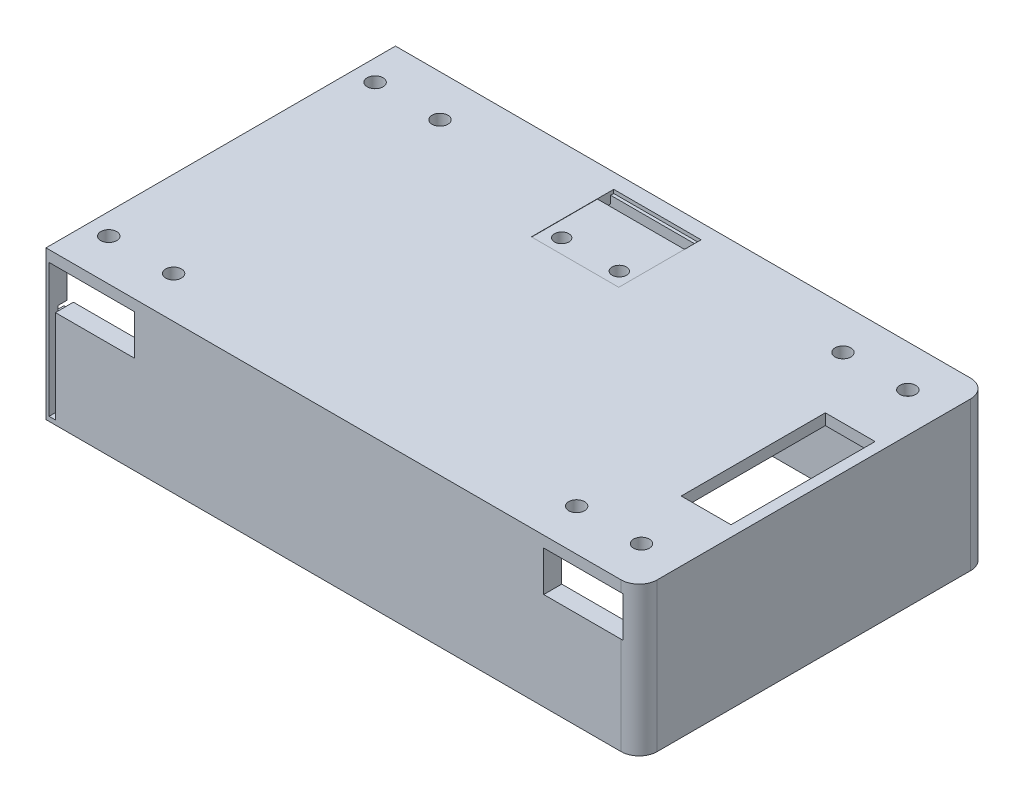
from build123d import *
from build123d.topology import SkipClean

# Parameters (mm, degrees)
CROQUIS1_W                  = 114
CROQUIS1_H                  = 34.2
SALIENTE_EXTRUIR1_DEPTH     = 97
VACIADO1_T                  = -5
SALIENTE_EXTRUIR2_DEPTH     = 97
CORTAR_EXTRUIR1_REACH       = 128.031
CROQUIS3_W                  = 13.814275766
CROQUIS3_H                  = 40
REDONDEO2_R                 = 5
CROQUIS6_W                  = 12.3
CROQUIS6_H                  = 10.4
CORTAR_EXTRUIR3_DEPTH       = 124.459670354
SALIENTE_EXTRUIR3_DEPTH     = 97
CROQUIS8_W                  = 13.814275766
CROQUIS8_H                  = 40
CORTAR_EXTRUIR4_DEPTH       = 127.030661617
CROQUIS9_W                  = 104
CROQUIS9_H                  = 87
CORTAR_EXTRUIR5_DEPTH       = 10
CORTAR_EXTRUIR6_START       = -33.316303
CROQUIS11_W                 = 1.5
CROQUIS11_H                 = 39.999512223
CROQUIS11_H_2               = 40
CORTAR_EXTRUIR6_DEPTH       = 33.316303
CORTAR_EXTRUIR7_START       = -33.316303
CROQUIS13_W                 = 15.314275766
CROQUIS13_H                 = 4.5
CORTAR_EXTRUIR7_DEPTH       = 33.316303
CROQUIS14_W                 = 40
CROQUIS14_H                 = 2.980218128
SALIENTE_EXTRUIR4_DEPTH     = 15.498885391
CORTAR_EXTRUIR8_DEPTH       = 20.498885391
CROQUIS19_W                 = 5
CROQUIS19_H                 = 21.536410229
CROQUIS19_H_2               = 2.349460024
SALIENTE_EXTRUIR5_DEPTH     = 22
CROQUIS20_W                 = 5
CROQUIS20_H                 = 36.296521374
SALIENTE_EXTRUIR6_DEPTH     = 19.5
CROQUIS21_W                 = 87
CROQUIS21_H                 = 2.349460024
SALIENTE_EXTRUIR7_DEPTH     = 144.815390375
CROQUIS23_W                 = 1.39816901
CROQUIS23_H                 = 33.700902132
CORTAR_EXTRUIR9_DEPTH       = 95.5
CROQUIS24_W                 = 22.493754325
CROQUIS24_H                 = 22.211308676
CORTAR_EXTRUIR10_DEPTH      = 1.5
CROQUIS25_W                 = 5.544572311
CROQUIS25_H                 = 16.748281631
CORTAR_EXTRUIR11_DEPTH      = 1.5
SALIENTE_EXTRUIR8_DEPTH     = 46
CROQUIS27_W                 = 22
CROQUIS27_H                 = 22
CORTAR_EXTRUIR12_DEPTH      = 1
CROQUIS28_W                 = 21.106040847
CROQUIS28_H                 = 4.330702007
CORTAR_EXTRUIR14_DEPTH      = 1.5
SALIENTE_EXTRUIR9_DEPTH     = 1.832280796
CROQUIS30_W                 = 21.106040847
CROQUIS30_H                 = 4.330702007
CORTAR_EXTRUIR15_DEPTH      = 10
CROQUIS31_W                 = 22
CROQUIS31_H                 = 22
CROQUIS31_W_2               = 24.249006592
CROQUIS31_H_2               = 22.850930842
CORTAR_EXTRUIR16_DEPTH      = 1
CROQUIS32_W                 = 27.93304274
CROQUIS32_H                 = 36.647527424
SALIENTE_EXTRUIR10_DEPTH    = 2.349460023
CROQUIS36_W                 = 87
CROQUIS36_H                 = 1.737561639
CROQUIS36_W_2               = 2.5
CORTAR_EXTRUIR17_DEPTH      = 147
SALIENTE_EXTRUIR11_START    = 5
CROQUIS37_W                 = 15.314275766
CROQUIS37_H                 = 48.999512223
SALIENTE_EXTRUIR11_DEPTH    = 5
CROQUIS38_W                 = 6
CROQUIS38_H                 = 6
CROQUIS38_R                 = 1.5
SALIENTE_EXTRUIR12_DEPTH    = 1.5
CROQUIS39_R                 = 1.5
CORTAR_EXTRUIR18_DEPTH      = 1.5
CROQUIS40_W                 = 1.75
CROQUIS40_H                 = 39
CORTAR_EXTRUIR19_DEPTH      = 95.5
CROQUIS41_W                 = 87
CROQUIS41_H                 = 12.325399335
CORTAR_EXTRUIR20_DEPTH      = 10
CROQUIS42_W                 = 22
CROQUIS42_H                 = 12.410651121
CROQUIS42_W_2               = 12.2
CROQUIS42_H_2               = 10.4
SALIENTE_EXTRUIR13_DEPTH    = 5
CORTAR_EXTRUIR21_REACH      = 139.785
CROQUIS43_W                 = 22
CROQUIS43_H                 = 9.218142551
SALIENTE_EXTRUIR14_REACH    = 139.785
CROQUIS46_R                 = 2.2
CORTAR_EXTRUIR22_DEPTH      = 1.078378822
CORTAR_EXTRUIR23_DEPTH      = 1.271081201
CROQUIS48_R                 = 2.2
CORTAR_EXTRUIR24_DEPTH      = 1.078378822
CORTAR_EXTRUIR25_DEPTH      = 1.018142551
CROQUIS50_W                 = 22
CROQUIS50_H                 = 13.185536059
CORTAR_EXTRUIR26_DEPTH      = 97
SALIENTE_EXTRUIR15_START    = 2
SALIENTE_EXTRUIR15_DEPTH    = 2
CROQUIS52_W                 = 48.73866477
CROQUIS52_H                 = 24.884100376
CORTAR_EXTRUIR27_DEPTH      = 10
CORTAR_EXTRUIR28_DEPTH      = 3
SALIENTE_EXTRUIR16_START    = 3
CROQUIS56_R                 = 2
SALIENTE_EXTRUIR16_DEPTH    = 3
CORTAR_EXTRUIR30_START      = -3
CROQUIS57_R                 = 2.2
CORTAR_EXTRUIR30_DEPTH      = 3
CORTAR_EXTRUIR31_DEPTH      = 10
CORTAR_EXTRUIR31_DEPTH_BACK = 14.629666
CROQUIS59_W                 = 16.895766511
CROQUIS59_H                 = 87.983147409
CORTAR_EXTRUIR32_DEPTH      = 3
SALIENTE_EXTRUIR17_DEPTH    = 3


with BuildPart() as part:
    # Croquis1 → Saliente-Extruir1 (new body)
    with BuildSketch(Plane.XY):
        with Locations((0, -8.9)):
            Rectangle(CROQUIS1_W, CROQUIS1_H)
    extrude(amount=-SALIENTE_EXTRUIR1_DEPTH)

    # Vaciado1
    vaciado1_openings = [part.faces().sort_by_distance(p)[0] for p in [
        (0, -26, -48.5),
    ]]
    offset(amount=VACIADO1_T, openings=vaciado1_openings, kind=Kind.INTERSECTION)

    # Croquis2 → Saliente-Extruir2 (add, through all)
    with BuildSketch(Plane(origin=(0, 0, -97), x_dir=(-1, 0, 0), z_dir=(0, 0, -1))):
        Polygon((71.814275766, 8.2), (67.33466189, 8.2), (67.33466189, -3.967393508), (57, -3.967393508), (57, -26), (67.33466189, -26), (71.814275766, -26), align=None)
        Polygon((-57, 8.2), (57, 8.2), (67.33466189, 8.2), (71.814275766, 8.2), (71.814275766, 10.296521374), (-71.814275766, 10.296521374), (-71.814275766, 8.2), (-67.33466189, 8.2), align=None)
        Polygon((-67.33466189, -3.967393508), (-67.33466189, 8.2), (-71.814275766, 8.2), (-71.814275766, -26), (-67.33466189, -26), (-57, -26), (-57, -3.967393508), align=None)
    extrude(amount=-SALIENTE_EXTRUIR2_DEPTH)

    # Croquis3 → Cortar-Extruir1 (cut, up to next)
    with BuildSketch(Plane.XZ.offset(26), mode=Mode.PRIVATE) as cortar_extruir1_sk1:
        with Locations((-61.907137883, -48.5)):
            Rectangle(CROQUIS3_W, CROQUIS3_H)
    cortar_extruir1_tool1 = extrude(cortar_extruir1_sk1.sketch, amount=-CORTAR_EXTRUIR1_REACH, mode=Mode.PRIVATE) & part.part
    # Croquis3 → Cortar-Extruir1 (cut, up to next)
    with BuildSketch(Plane.XZ.offset(26), mode=Mode.PRIVATE) as cortar_extruir1_sk2:
        with Locations((61.907137883, -48.5)):
            Rectangle(CROQUIS3_W, CROQUIS3_H)
    cortar_extruir1_tool2 = extrude(cortar_extruir1_sk2.sketch, amount=-CORTAR_EXTRUIR1_REACH, mode=Mode.PRIVATE) & part.part
    add(cortar_extruir1_tool1.solids().sort_by_distance((-61.907138, -26, -48.5))[0], mode=Mode.SUBTRACT)
    add(cortar_extruir1_tool2.solids().sort_by_distance((61.907138, -26, -48.5))[0], mode=Mode.SUBTRACT)

    # Redondeo2
    # the kernel refuses this fillet: 5 mm, written as the material it takes off along each edge
    with BuildSketch(Plane(origin=(71.814275766, -38.5, -97), x_dir=(0, 0, 1), z_dir=(0, 1, 0)), Plane(origin=(71.814275766, -38.5, 0), x_dir=(-1, 0, 0), z_dir=(0, 1, 0)), Plane(origin=(-71.814275766, 22.796521374, -97), x_dir=(0, 0, 1), z_dir=(0, -1, 0)), Plane(origin=(-71.814275766, 22.796521374, 0), x_dir=(1, 0, 0), z_dir=(0, -1, 0))) as redondeo2_piece_1:
        with BuildLine():
            CenterArc((REDONDEO2_R, -REDONDEO2_R), REDONDEO2_R, 90, 90)
            Line((0, -REDONDEO2_R), (0, 0))
            Line((0, 0), (REDONDEO2_R, 0))
        make_face()
    extrude(amount=61.296521374, mode=Mode.SUBTRACT)

    # Croquis6 → Cortar-Extruir3 (cut, through all)
    with BuildSketch(Plane(origin=(0, 0, -97), x_dir=(-1, 0, 0), z_dir=(0, 0, -1))):
        with Locations((-60.617330945, 2.116303246)):
            Rectangle(CROQUIS6_W, CROQUIS6_H)
        with Locations((60.617330945, 2.116303246)):
            Rectangle(CROQUIS6_W, CROQUIS6_H)
    extrude(amount=-CORTAR_EXTRUIR3_DEPTH, mode=Mode.SUBTRACT)

    # Croquis7 → Saliente-Extruir3 (add, through all)
    with BuildSketch(Plane(origin=(0, 0, -97), x_dir=(-1, 0, 0), z_dir=(0, 0, -1))):
        Polygon((57, 8.2), (57, 7.316303246), (66.667330945, 7.316303246), (66.667330945, -3.083696754), (57, -3.083696754), (57, -3.967393508), (66.814275766, -3.967393508), (67.33466189, -3.967393508), (67.33466189, 8.2), (66.814275766, 8.2), align=None)
        Polygon((-66.667330945, 7.32503221), (-57, 7.32503221), (-57, 8.2), (-66.814275766, 8.2), (-67.33466189, 8.2), (-67.33466189, -3.967393508), (-66.814275766, -3.967393508), (-57, -3.967393508), (-57, -3.083696754), (-66.667330945, -3.083696754), align=None)
    extrude(amount=-SALIENTE_EXTRUIR3_DEPTH)

    # Croquis8 → Cortar-Extruir4 (cut, through all)
    with BuildSketch(Plane(origin=(0, 10.296521374, 0), x_dir=(1, 0, 0), z_dir=(0, 1, 0))):
        with Locations((-61.907137883, 48.5)):
            Rectangle(CROQUIS8_W, CROQUIS8_H)
        with Locations((61.907137883, 48.5)):
            Rectangle(CROQUIS8_W, CROQUIS8_H)
    extrude(amount=-CORTAR_EXTRUIR4_DEPTH, mode=Mode.SUBTRACT)

    # Croquis9 → Cortar-Extruir5 (cut)
    with BuildSketch(Plane.XZ.offset(-3.2)):
        with Locations((0, -48.5)):
            Rectangle(CROQUIS9_W, CROQUIS9_H)
    extrude(amount=-CORTAR_EXTRUIR5_DEPTH, mode=Mode.SUBTRACT)

    # Croquis11 → Cortar-Extruir6 (cut)
    with SkipClean():  # the faces are left unmerged after this step: merging them gives an invalid solid
        with BuildSketch(Plane.XZ.offset(26).offset(CORTAR_EXTRUIR6_START)):
            with Locations((54.25, -48.499756112)):
                Rectangle(CROQUIS11_W, CROQUIS11_H)
            with Locations((-54.25, -48.5)):
                Rectangle(CROQUIS11_W, CROQUIS11_H_2)
        extrude(amount=CORTAR_EXTRUIR6_DEPTH, mode=Mode.SUBTRACT)

    # Croquis13 → Cortar-Extruir7 (cut)
    with BuildSketch(Plane.XZ.offset(26).offset(CORTAR_EXTRUIR7_START)):
        with Locations((-61.157137883, -26.25)):
            Rectangle(CROQUIS13_W, CROQUIS13_H)
        with Locations((-61.157137883, -70.75)):
            Rectangle(CROQUIS13_W, CROQUIS13_H)
        with Locations((61.157137883, -26.25)):
            Rectangle(CROQUIS13_W, CROQUIS13_H)
        with Locations((61.157137883, -70.749512223)):
            Rectangle(CROQUIS13_W, CROQUIS13_H)
    extrude(amount=CORTAR_EXTRUIR7_DEPTH, mode=Mode.SUBTRACT)

    # Croquis14 → Saliente-Extruir4 (add)
    with BuildSketch(Plane.ZY.offset(55)):
        with Locations((-48.5, 8.80641231)):
            Rectangle(CROQUIS14_W, CROQUIS14_H)
    extrude(amount=SALIENTE_EXTRUIR4_DEPTH)

    # Croquis16 → Cortar-Extruir8 (cut)
    with BuildSketch(Plane.ZY.offset(71.814275766)):
        Polygon((-5, 10.296521374), (-98.41592061, 10.296521374), (-98.41592061, -27.13789471), (0, -27.13789471), (0, 10.296521374), align=None)
    extrude(amount=-CORTAR_EXTRUIR8_DEPTH, mode=Mode.SUBTRACT)

    # Croquis19 → Saliente-Extruir5 (add)
    with BuildSketch(Plane.ZY.offset(51.315390375)):
        with Locations((-2.5, -15.231794886)):
            Rectangle(CROQUIS19_W, CROQUIS19_H)
        with Locations((-94.5, -15.231794886)):
            Rectangle(CROQUIS19_W, CROQUIS19_H)
        with Locations((-2.5, 9.121791362)):
            Rectangle(CROQUIS19_W, CROQUIS19_H_2)
        with Locations((-94.5, 9.121791362)):
            Rectangle(CROQUIS19_W, CROQUIS19_H_2)
    extrude(amount=SALIENTE_EXTRUIR5_DEPTH)

    # Croquis20 → Saliente-Extruir6 (add)
    with BuildSketch(Plane.ZY.offset(73.315390375)):
        with Locations((-2.5, -7.851739313)):
            Rectangle(CROQUIS20_W, CROQUIS20_H)
        with Locations((-94.5, -7.851739313)):
            Rectangle(CROQUIS20_W, CROQUIS20_H)
    extrude(amount=SALIENTE_EXTRUIR6_DEPTH)

    # Croquis21 → Saliente-Extruir7 (add)
    with BuildSketch(Plane.ZY.offset(-52)):
        with Locations((-48.5, 9.121791362)):
            Rectangle(CROQUIS21_W, CROQUIS21_H)
    extrude(amount=SALIENTE_EXTRUIR7_DEPTH)

    # Croquis23 → Cortar-Extruir9 (cut)
    with BuildSketch(Plane.XY):
        with Locations((-91.682194084, -7.778032427)):
            Rectangle(CROQUIS23_W, CROQUIS23_H)
    extrude(amount=-CORTAR_EXTRUIR9_DEPTH, mode=Mode.SUBTRACT)

    # Croquis24 → Cortar-Extruir10 (cut)
    with BuildSketch(Plane(origin=(0, 10.296521374, 0), x_dir=(1, 0, 0), z_dir=(0, 1, 0))):
        with Locations((-78.515448222, 48.5)):
            Rectangle(CROQUIS24_W, CROQUIS24_H)
    extrude(amount=-CORTAR_EXTRUIR10_DEPTH, mode=Mode.SUBTRACT)

    # Croquis25 → Cortar-Extruir11 (cut)
    with BuildSketch(Plane(origin=(0, 8.796521374, 0), x_dir=(1, 0, 0), z_dir=(0, 1, 0))):
        with Locations((-86.990039229, 48.639589487)):
            Rectangle(CROQUIS25_W, CROQUIS25_H)
    extrude(amount=-CORTAR_EXTRUIR11_DEPTH, mode=Mode.SUBTRACT)

    # Croquis26 → Saliente-Extruir8 (add)
    with BuildSketch(Plane(origin=(-89.762325384, 0, 0), x_dir=(0, 0, -1), z_dir=(1, 0, 0))):
        Polygon((59.605654338, 10.296521374), (37.394345662, 10.296521374), (37.394345662, 8.796521374), (40.265448671, 8.796521374), (40.265448671, 7.94706135), (57.013730302, 7.94706135), (57.013730302, 8.796521374), (59.605654338, 8.796521374), align=None)
    extrude(amount=SALIENTE_EXTRUIR8_DEPTH)

    # Croquis27 → Cortar-Extruir12 (cut)
    with BuildSketch(Plane(origin=(0, 10.296521374, 0), x_dir=(1, 0, 0), z_dir=(0, 1, 0))):
        with Locations((-71.548762692, 81)):
            Rectangle(CROQUIS27_W, CROQUIS27_H)
    extrude(amount=-CORTAR_EXTRUIR12_DEPTH, mode=Mode.SUBTRACT)

    # Croquis28 → Cortar-Extruir14 (cut)
    with BuildSketch(Plane(origin=(0, 9.296521374, 0), x_dir=(1, 0, 0), z_dir=(0, 1, 0))):
        with Locations((-71.487233446, 89.534648997)):
            Rectangle(CROQUIS28_W, CROQUIS28_H)
    extrude(amount=-CORTAR_EXTRUIR14_DEPTH, mode=Mode.SUBTRACT)

    # Croquis29 → Saliente-Extruir9 (add)
    with BuildSketch(Plane.ZY.offset(90.983109579)):
        Polygon((-92, 7.94706135), (-5, 7.94706135), (-5, -24.628483493), (0, -24.628483493), (0, 9.072418639), (-95.5, 9.072418639), (-95.5, -24.628483493), (-92, -24.628483493), align=None)
    extrude(amount=SALIENTE_EXTRUIR9_DEPTH)

    # Croquis30 → Cortar-Extruir15 (cut)
    with BuildSketch(Plane.XZ.offset(-7.94706135)):
        with Locations((-16.385259295, -89.834648996)):
            Rectangle(CROQUIS30_W, CROQUIS30_H)
        with Locations((-71.487233446, -89.534648997)):
            Rectangle(CROQUIS30_W, CROQUIS30_H)
    extrude(amount=-CORTAR_EXTRUIR15_DEPTH, mode=Mode.SUBTRACT)

    # Croquis31 → Cortar-Extruir16 (cut)
    with BuildSketch(Plane(origin=(0, 10.296521374, 0), x_dir=(1, 0, 0), z_dir=(0, 1, 0))):
        with Locations((-71.548762692, 81)):
            Rectangle(CROQUIS31_W, CROQUIS31_H)
        with Locations((-15.962454673, 81.425465421)):
            Rectangle(CROQUIS31_W_2, CROQUIS31_H_2)
    extrude(amount=-CORTAR_EXTRUIR16_DEPTH, mode=Mode.SUBTRACT)

    # Croquis32 → Saliente-Extruir10 (add)
    with BuildSketch(Plane.XZ.offset(-7.94706135)):
        with Locations((-69.098869005, -73.676236288)):
            Rectangle(CROQUIS32_W, CROQUIS32_H)
    extrude(amount=-SALIENTE_EXTRUIR10_DEPTH)

    # Croquis36 → Cortar-Extruir17 (cut)
    with BuildSketch(Plane.ZY.offset(92.815390375)):
        with Locations((-48.5, -5.247118805)):
            Rectangle(CROQUIS36_W, CROQUIS36_H)
        with Locations((-3.75, -5.247118805)):
            Rectangle(CROQUIS36_W_2, CROQUIS36_H)
        with Locations((-93.25, -5.247118805)):
            Rectangle(CROQUIS36_W_2, CROQUIS36_H)
    extrude(amount=-CORTAR_EXTRUIR17_DEPTH, mode=Mode.SUBTRACT)

    # Croquis37 → Saliente-Extruir11 (add)
    with BuildSketch(Plane.XZ.offset(26).offset(SALIENTE_EXTRUIR11_START)):
        with BuildLine():
            Line((66.814275766, 0), (-92.815390375, 0))
            Line((-92.815390375, 0), (-92.815390375, -5))
            Line((-92.815390375, -5), (52, -5))
            Line((52, -5), (52, -92))
            Line((52, -92), (-92.815390375, -92))
            Line((-92.815390375, -92), (-92.815390375, -97))
            Line((-92.815390375, -97), (66.814275766, -97))
            ThreePointArc((66.814275766, -97), (70.349809672, -95.535533906), (71.814275766, -92))
            Line((71.814275766, -92), (71.814275766, -5))
            ThreePointArc((71.814275766, -5), (70.349809672, -1.464466094), (66.814275766, 0))
        make_face()
        with Locations((61.157137883, -48.499756112)):
            Rectangle(CROQUIS37_W, CROQUIS37_H, mode=Mode.SUBTRACT)
    extrude(amount=-SALIENTE_EXTRUIR11_DEPTH)

    # Croquis38 → Saliente-Extruir12 (add)
    # profile 1 of 4: a face of its own
    with BuildSketch(Plane.XZ.offset(31)):
        with Locations((49, -8)):
            Rectangle(CROQUIS38_W, CROQUIS38_H)
        with Locations((49, -8)):
            Circle(CROQUIS38_R, mode=Mode.SUBTRACT)
    # profile 2 of 4: a face of its own
    with BuildSketch(Plane.XZ.offset(31)):
        with Locations((49, -89)):
            Rectangle(CROQUIS38_W, CROQUIS38_H)
        with Locations((49, -89)):
            Circle(CROQUIS38_R, mode=Mode.SUBTRACT)
    # profile 3 of 4: a face of its own
    with BuildSketch(Plane.XZ.offset(31)):
        with Locations((-69.904912693, -89)):
            Rectangle(CROQUIS38_W, CROQUIS38_H)
    # profile 4 of 4: a face of its own
    with BuildSketch(Plane.XZ.offset(31)):
        with Locations((-70.315390375, -8)):
            Rectangle(CROQUIS38_W, CROQUIS38_H)
        with Locations((-70.315390375, -8)):
            Circle(CROQUIS38_R, mode=Mode.SUBTRACT)
    extrude(amount=-SALIENTE_EXTRUIR12_DEPTH)

    # Croquis39 → Cortar-Extruir18 (cut)
    with BuildSketch(Plane.XZ.offset(31)):
        with Locations((-69.850202166, -89.208902584)):
            Circle(CROQUIS39_R)
    extrude(amount=-CORTAR_EXTRUIR18_DEPTH, mode=Mode.SUBTRACT)

    # Croquis40 → Cortar-Extruir19 (cut)
    with BuildSketch(Plane.XY):
        with Locations((-91.085120413, -10.281857449)):
            Rectangle(CROQUIS40_W, CROQUIS40_H)
    extrude(amount=-CORTAR_EXTRUIR19_DEPTH, mode=Mode.SUBTRACT)

    # Croquis41 → Cortar-Extruir20 (cut)
    with BuildSketch(Plane.ZY.offset(-52)):
        with Locations((-48.5, 1.784361683)):
            Rectangle(CROQUIS41_W, CROQUIS41_H)
    extrude(amount=-CORTAR_EXTRUIR20_DEPTH, mode=Mode.SUBTRACT)

    # Croquis42 → Saliente-Extruir13 (add)
    with BuildSketch(Plane.XY):
        with Locations((-62.315390375, 1.741735789)):
            Rectangle(CROQUIS42_W, CROQUIS42_H)
        with Locations((60.567330945, 2.116303246)):
            Rectangle(CROQUIS42_W_2, CROQUIS42_H_2)
    extrude(amount=-SALIENTE_EXTRUIR13_DEPTH)

    # Cortar-Extruir21: up to this face of the body (flat: up to its plane)
    cortar_extruir21_end = Plane(part.part.faces().sort_by_distance((-12.253431267, -11.127159032, -97))[0])
    # Croquis43 → Cortar-Extruir21 (cut, up to the picked face)
    with BuildSketch(Plane.XY, mode=Mode.PRIVATE) as cortar_extruir21_sk1:
        Polygon((67.33466189, -3.967393508), (67.33466189, -3.72257343), (67.33466189, 8.2), (45.33466189, 8.2), (45.33466189, -3.72257343), (45.33466189, -3.967393508), align=None)
    cortar_extruir21_tool1 = split(extrude(cortar_extruir21_sk1.sketch, amount=-CORTAR_EXTRUIR21_REACH, mode=Mode.PRIVATE), bisect_by=cortar_extruir21_end, keep=Keep.BOTH, mode=Mode.PRIVATE)
    # Croquis43 → Cortar-Extruir21 (cut, up to the picked face)
    with BuildSketch(Plane.XY, mode=Mode.PRIVATE) as cortar_extruir21_sk2:
        with Locations((-79.210120413, 4.609071276)):
            Rectangle(CROQUIS43_W, CROQUIS43_H)
    cortar_extruir21_tool2 = split(extrude(cortar_extruir21_sk2.sketch, amount=-CORTAR_EXTRUIR21_REACH, mode=Mode.PRIVATE), bisect_by=cortar_extruir21_end, keep=Keep.BOTH, mode=Mode.PRIVATE)
    add(cortar_extruir21_tool1.solids().sort_by(Axis((56.334662, 2.116303, 0), (0, 0, -1)))[0], mode=Mode.SUBTRACT)
    add(cortar_extruir21_tool2.solids().sort_by(Axis((-79.21012, 4.609071, 0), (0, 0, -1)))[0], mode=Mode.SUBTRACT)

    # Saliente-Extruir14: up to this face of the body (flat: up to its plane)
    saliente_extruir14_end = Plane(part.part.faces().sort_by_distance((-92.387755394, 1.784361683, -92))[0])
    # Croquis44 → Saliente-Extruir14 (add, up to the picked face)
    with BuildSketch(Plane(origin=(0, 0, -97), x_dir=(-1, 0, 0), z_dir=(0, 0, -1)), mode=Mode.PRIVATE) as saliente_extruir14_sk1:
        Polygon((68.210120413, 7.94706135), (68.210120413, 0), (73.315390375, 0), (73.315390375, -4.378337985), (51.315390375, -4.463589771), (51.315390375, 7.94706135), align=None)
    saliente_extruir14_tool1 = split(extrude(saliente_extruir14_sk1.sketch, amount=-SALIENTE_EXTRUIR14_REACH, mode=Mode.PRIVATE), bisect_by=saliente_extruir14_end, keep=Keep.BOTH, mode=Mode.PRIVATE)
    add(saliente_extruir14_tool1.solids().sort_by(Axis((-60.82024, 1.37566, -97), (0, 0, 1)))[0])

    # Croquis46 → Cortar-Extruir22 (cut)
    with BuildSketch(Plane.XZ.offset(-9.218142551)):
        with Locations(Location((-68.930805644, -85.465549869, 0), (0, 0, 289.122211446))):
            Circle(CROQUIS46_R)
        with Locations(Location((-86.930805644, -85.465549869, 0), (0, 0, 270))):
            Circle(CROQUIS46_R)
        with Locations(Location((-68.930805644, -11.534450131, 0), (0, 0, 289.122211446))):
            Circle(CROQUIS46_R)
        with Locations(Location((-86.930805644, -11.534450131, 0), (0, 0, 90))):
            Circle(CROQUIS46_R)
    extrude(amount=-CORTAR_EXTRUIR22_DEPTH, mode=Mode.SUBTRACT)

    # Croquis47 → Cortar-Extruir23 (cut)
    with BuildSketch(Plane.XZ.offset(-7.94706135)):
        Polygon((-68.210120413, -5), (-68.210120413, -92), (-26.938279719, -92), (-26.938279719, -87.669297993), (-5.832238872, -87.669297993), (-5.832238872, -92), (45.33466189, -92), (45.33466189, -5), align=None)
    extrude(amount=-CORTAR_EXTRUIR23_DEPTH, mode=Mode.SUBTRACT)

    # Croquis48 → Cortar-Extruir24 (cut)
    with BuildSketch(Plane.XZ.offset(-9.218142551)):
        with Locations(Location((42.929691035, -85.465549869, 0), (0, 0, 90))):
            Circle(CROQUIS48_R)
        with Locations(Location((-68.930805644, -85.465549869, 0), (0, 0, 270))):
            Circle(CROQUIS48_R)
        with Locations(Location((-86.930805644, -11.534450131, 0), (0, 0, 90))):
            Circle(CROQUIS48_R)
        with Locations(Location((-86.930805644, -85.465549869, 0), (0, 0, 270))):
            Circle(CROQUIS48_R)
        with Locations(Location((-68.930805644, -11.534450131, 0), (0, 0, 90))):
            Circle(CROQUIS48_R)
        with Locations(Location((60.929691035, -85.465549869, 0), (0, 0, 90))):
            Circle(CROQUIS48_R)
        with Locations(Location((42.929691035, -11.534450131, 0), (0, 0, 90))):
            Circle(CROQUIS48_R)
        with Locations(Location((60.929691035, -11.534450131, 0), (0, 0, 90))):
            Circle(CROQUIS48_R)
    extrude(amount=-CORTAR_EXTRUIR24_DEPTH, mode=Mode.SUBTRACT)

    # Croquis49 → Cortar-Extruir25 (cut)
    with BuildSketch(Plane.XZ.offset(-8.2)):
        with BuildLine():
            Line((67.33466189, -68.5), (55, -68.5))
            Line((55, -68.5), (55, -28.5))
            Line((55, -28.5), (67.33466189, -28.5))
            Line((67.33466189, -28.5), (67.33466189, -0.027153905))
            ThreePointArc((67.33466189, -0.027153905), (67.074822812, -0.006793091), (66.814275766, 0))
            Line((66.814275766, 0), (45.33466189, 0))
            Line((45.33466189, 0), (45.33466189, -5))
            Line((45.33466189, -5), (45.33466189, -92))
            Line((45.33466189, -92), (45.33466189, -97))
            Line((45.33466189, -97), (66.814275766, -97))
            ThreePointArc((66.814275766, -97), (67.074822812, -96.993206909), (67.33466189, -96.972846095))
            Line((67.33466189, -96.972846095), (67.33466189, -68.5))
        make_face()
    extrude(amount=-CORTAR_EXTRUIR25_DEPTH, mode=Mode.SUBTRACT)

    # Croquis50 → Cortar-Extruir26 (cut)
    with BuildSketch(Plane(origin=(0, 0, -97), x_dir=(-1, 0, 0), z_dir=(0, 0, -1))):
        with Locations((79.210120413, 2.625374522)):
            Rectangle(CROQUIS50_W, CROQUIS50_H)
        with Locations((-56.33466189, 2.625374522)):
            Rectangle(CROQUIS50_W, CROQUIS50_H)
    extrude(amount=-CORTAR_EXTRUIR26_DEPTH, mode=Mode.SUBTRACT)

    # Croquis51 → Saliente-Extruir15 (add)
    with BuildSketch(Plane.XZ.offset(-9.218142551).offset(SALIENTE_EXTRUIR15_START)):
        with BuildLine():
            Line((45.33466189, -5), (-68.210120413, -5))
            Line((-68.210120413, -5), (-68.210120413, 0))
            Line((-68.210120413, 0), (-91.960120413, 0))
            Line((-91.960120413, 0), (-91.960120413, -95.5))
            Line((-91.960120413, -95.5), (-90.210120413, -95.5))
            Line((-90.210120413, -95.5), (-90.210120413, -97))
            Line((-90.210120413, -97), (-68.210120413, -97))
            Line((-68.210120413, -97), (-68.210120413, -92))
            Line((-68.210120413, -92), (-26.938279719, -92))
            Line((-26.938279719, -92), (-26.938279719, -87.669297993))
            Line((-26.938279719, -87.669297993), (-5.832238872, -87.669297993))
            Line((-5.832238872, -87.669297993), (-5.832238872, -92))
            Line((-5.832238872, -92), (45.33466189, -92))
            Line((45.33466189, -92), (45.33466189, -97))
            Line((45.33466189, -97), (66.814275766, -97))
            ThreePointArc((66.814275766, -97), (67.074822812, -96.993206909), (67.33466189, -96.972846095))
            Line((67.33466189, -96.972846095), (67.33466189, -68.5))
            Line((67.33466189, -68.5), (55, -68.5))
            Line((55, -68.5), (55, -28.5))
            Line((55, -28.5), (67.33466189, -28.5))
            Line((67.33466189, -28.5), (67.33466189, -0.027153905))
            ThreePointArc((67.33466189, -0.027153905), (67.074822812, -0.006793091), (66.814275766, 0))
            Line((66.814275766, 0), (45.33466189, 0))
            Line((45.33466189, 0), (45.33466189, -5))
        make_face()
    extrude(amount=-SALIENTE_EXTRUIR15_DEPTH)

    # Croquis52 → Cortar-Extruir27 (cut)
    with BuildSketch(Plane.ZY.offset(-52)):
        with Locations((-48.630179838, -18.557949812)):
            Rectangle(CROQUIS52_W, CROQUIS52_H)
    extrude(amount=-CORTAR_EXTRUIR27_DEPTH, mode=Mode.SUBTRACT)

    # Croquis53 → Cortar-Extruir28 (cut)
    with BuildSketch(Plane.XZ.offset(-7.218142551)):
        with BuildLine():
            Line((45.33466189, 0), (45.33466189, -5))
            Line((45.33466189, -5), (-68.210120413, -5))
            Line((-68.210120413, -5), (-68.210120413, 0))
            Line((-68.210120413, 0), (-91.960120413, 0))
            Line((-91.960120413, 0), (-91.960120413, -5))
            Line((-91.960120413, -5), (-91.960120413, -92))
            Line((-91.960120413, -92), (-91.960120413, -95.5))
            Line((-91.960120413, -95.5), (-90.210120413, -95.5))
            Line((-90.210120413, -95.5), (-90.210120413, -97))
            Line((-90.210120413, -97), (-68.210120413, -97))
            Line((-68.210120413, -97), (-68.210120413, -92))
            Line((-68.210120413, -92), (-26.938279719, -92))
            Line((-26.938279719, -92), (-26.938279719, -87.669297993))
            Line((-26.938279719, -87.669297993), (-5.832238872, -87.669297993))
            Line((-5.832238872, -87.669297993), (-5.832238872, -92))
            Line((-5.832238872, -92), (45.33466189, -92))
            Line((45.33466189, -92), (45.33466189, -97))
            Line((45.33466189, -97), (66.814275766, -97))
            ThreePointArc((66.814275766, -97), (67.074822812, -96.993206909), (67.33466189, -96.972846095))
            Line((67.33466189, -96.972846095), (67.33466189, -72.999512223))
            Line((67.33466189, -72.999512223), (67.33466189, -68.5))
            Line((67.33466189, -68.5), (55, -68.5))
            Line((55, -68.5), (55, -28.5))
            Line((55, -28.5), (67.33466189, -28.5))
            Line((67.33466189, -28.5), (67.33466189, -24))
            Line((67.33466189, -24), (67.33466189, -0.027153905))
            ThreePointArc((67.33466189, -0.027153905), (67.074822812, -0.006793091), (66.814275766, 0))
            Line((66.814275766, 0), (45.33466189, 0))
        make_face()
    extrude(amount=-CORTAR_EXTRUIR28_DEPTH, mode=Mode.SUBTRACT)

    # Croquis56 → Saliente-Extruir16 (add)
    with BuildSketch(Plane.XZ.offset(-10.218142551).offset(SALIENTE_EXTRUIR16_START)):
        with BuildLine():
            Line((-28.086957969, -88.323078933), (-3.837951377, -88.323078933))
            Line((-3.837951377, -88.323078933), (-3.837951377, -92))
            Line((-3.837951377, -92), (45.33466189, -92))
            Line((45.33466189, -92), (45.33466189, -97))
            Line((45.33466189, -97), (66.814275766, -97))
            ThreePointArc((66.814275766, -97), (67.074822812, -96.993206909), (67.33466189, -96.972846095))
            Line((67.33466189, -96.972846095), (67.33466189, -68.5))
            Line((67.33466189, -68.5), (55, -68.5))
            Line((55, -68.5), (55, -28.5))
            Line((55, -28.5), (67.33466189, -28.5))
            Line((67.33466189, -28.5), (67.33466189, -0.027153905))
            ThreePointArc((67.33466189, -0.027153905), (67.074822812, -0.006793091), (66.814275766, 0))
            Line((66.814275766, 0), (45.33466189, 0))
            Line((45.33466189, 0), (45.33466189, -5))
            Line((45.33466189, -5), (-68.210120413, -5))
            Line((-68.210120413, -5), (-68.210120413, 0))
            Line((-68.210120413, 0), (-91.960120413, 0))
            Line((-91.960120413, 0), (-91.960120413, -95.5))
            Line((-91.960120413, -95.5), (-90.210120413, -95.5))
            Line((-90.210120413, -95.5), (-90.210120413, -97))
            Line((-90.210120413, -97), (-68.210120413, -97))
            Line((-68.210120413, -97), (-68.210120413, -92))
            Line((-68.210120413, -92), (-28.086957969, -92))
            Line((-28.086957969, -92), (-28.086957969, -88.323078933))
        make_face()
        with Locations(Location((-23.729260061, -74.041931389, 0), (0, 0, 270))):
            Circle(CROQUIS56_R, mode=Mode.SUBTRACT)
        with Locations(Location((-7.729260061, -74.041931389, 0), (0, 0, 270))):
            Circle(CROQUIS56_R, mode=Mode.SUBTRACT)
    extrude(amount=-SALIENTE_EXTRUIR16_DEPTH)

    # Croquis57 → Cortar-Extruir30 (cut)
    with BuildSketch(Plane(origin=(0, 10.218142551, 0), x_dir=(1, 0, 0), z_dir=(0, 1, 0)).offset(CORTAR_EXTRUIR30_START)):
        with Locations(Location((-68.930805644, 85.465549869, 0), (0, 0, 270))):
            Circle(CROQUIS57_R)
        with Locations(Location((60.929691035, 85.465549869, 0), (0, 0, 270))):
            Circle(CROQUIS57_R)
        with Locations(Location((42.929691035, 85.465549869, 0), (0, 0, 270))):
            Circle(CROQUIS57_R)
        with Locations(Location((60.929691035, 11.534450131, 0), (0, 0, 270))):
            Circle(CROQUIS57_R)
        with Locations(Location((42.929691035, 11.534450131, 0), (0, 0, 270))):
            Circle(CROQUIS57_R)
        with Locations(Location((-68.930805644, 11.534450131, 0), (0, 0, 270))):
            Circle(CROQUIS57_R)
        with Locations(Location((-86.930805644, 11.534450131, 0), (0, 0, 270))):
            Circle(CROQUIS57_R)
        with Locations(Location((-86.930805644, 85.465549869, 0), (0, 0, 270))):
            Circle(CROQUIS57_R)
    extrude(amount=CORTAR_EXTRUIR30_DEPTH, mode=Mode.SUBTRACT)

    # Croquis58 → Cortar-Extruir31 (cut, two sides: drawn at the far end of the back side and taken through both)
    with BuildSketch(Plane.ZY.offset(-54.184609625).offset(-CORTAR_EXTRUIR31_DEPTH_BACK)):
        Polygon((-5, -4.378337985), (-24, -4.378337985), (-24, -6.115899624), (-2.5, -6.115899624), (-2.5, -4.378337985), align=None)
        Polygon((-92, -6.115899624), (-92, -29.5), (-86, -29.5), (-72.999512223, -29.5), (-72.999512223, -6.115899624), (-72.999512223, -4.378337985), (-92, -4.378337985), (-94.5, -4.378337985), (-94.5, -6.115899624), align=None)
        Polygon((-24.260847453, -6.115899624), (-24.260847453, -29.5), (-11, -29.5), (-5, -29.5), (-5, -6.115899624), (-24, -6.115899624), align=None)
    extrude(amount=CORTAR_EXTRUIR31_DEPTH + CORTAR_EXTRUIR31_DEPTH_BACK, mode=Mode.SUBTRACT)

    # Croquis59 → Cortar-Extruir32 (cut)
    with BuildSketch(Plane.XZ.offset(4.378337985)):
        with Locations((60.447883256, -48.991573705)):
            Rectangle(CROQUIS59_W, CROQUIS59_H)
    extrude(amount=-CORTAR_EXTRUIR32_DEPTH, mode=Mode.SUBTRACT)

    # Croquis60 → Saliente-Extruir17 (add)
    with BuildSketch(Plane.XZ.offset(1.378337985)):
        Polygon((67.33466189, -72.999512223), (67.33466189, -92.983147409), (68.895766511, -92.983147409), (68.895766511, -5), (67.33466189, -5), (67.33466189, -24), (68.814275766, -24), (68.814275766, -72.999512223), align=None)
    extrude(amount=SALIENTE_EXTRUIR17_DEPTH)


solid = part.part
